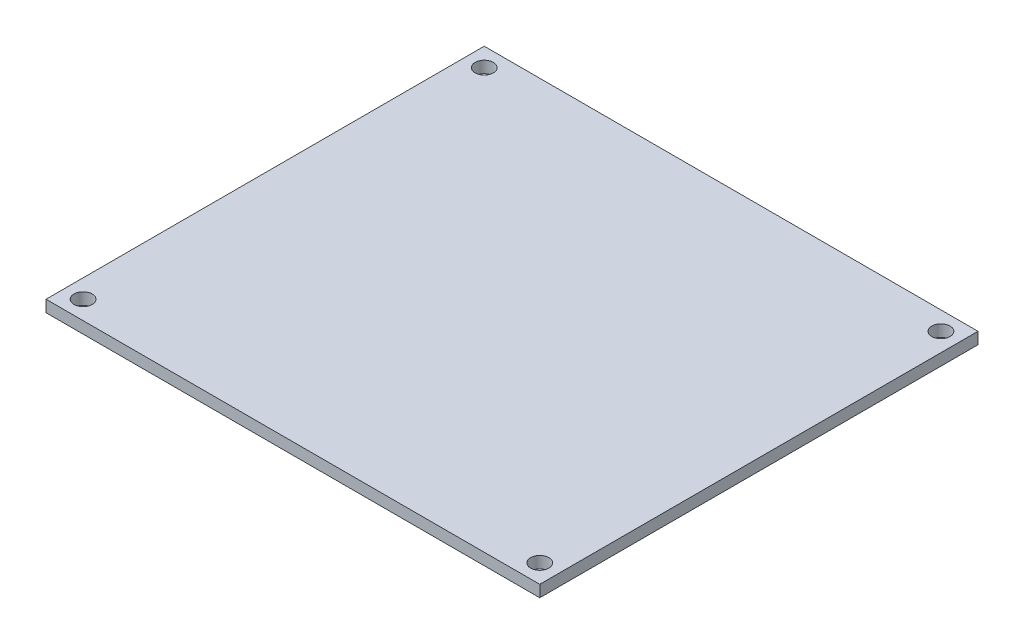
from build123d import *

# Parameters (mm, degrees)
SKETCH1_W             = 67.6
SKETCH1_H             = 60
BOSS_EXTRUDE1_DEPTH   = 1.6
F_2_5MM_DOWEL_HOLE1_D = 2.5


with BuildPart() as part:
    # Sketch1 → Boss-Extrude1 (new body)
    with BuildSketch(Plane(origin=(0, 0, 0), x_dir=(1, 0, 0), z_dir=(0, 1, 0))):
        Rectangle(SKETCH1_W, SKETCH1_H)
    extrude(amount=BOSS_EXTRUDE1_DEPTH)

    # Ø2.5mm Dowel Hole1 (through all)
    with Locations(Plane(origin=(0, 1.6, 0), x_dir=(1, 0, 0), z_dir=(0, 1, 0))):
        with Locations((-31.26, 27.46), (31.26, 27.46), (31.26, -27.46), (-31.26, -27.46)):
            Hole(F_2_5MM_DOWEL_HOLE1_D / 2)


solid = part.part
